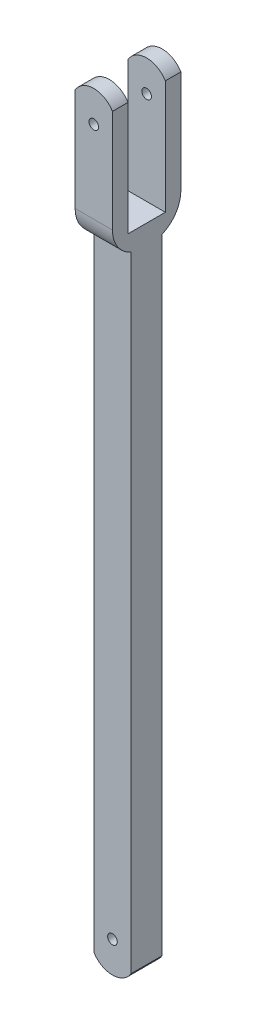
from build123d import *

# Parameters (mm, degrees)
BOSS_EXTRU_1_DEPTH      = 11
BOSS_EXTRU_1_DEPTH_BACK = 11
ESQUISSE3_W             = 16.581408451
ESQUISSE3_H             = 12
ENL_V_MAT_EXTRU_2_DEPTH = 40
CUT_EXTRUDE1_REACH      = 158.809
SKETCH1_R               = 1.55
CUT_EXTRUDE2_DEPTH      = 6
FILLET1_R               = 10


with BuildPart() as part:
    # Esquisse1 → Boss.-Extru.1 (new, two sides: drawn at the far end of the back side and taken through both)
    with BuildSketch(Plane.XY.offset(-BOSS_EXTRU_1_DEPTH_BACK)):
        with BuildLine():
            Line((-6.828531952, -151.713036206), (-6.828531952, 91.498065413))
            ThreePointArc((-6.828531952, 91.498065413), (-0.828532479, 94.89251507), (5.171468048, 91.498067278))
            Line((5.171468048, 91.498067278), (5.171468048, -151.713036206))
            ThreePointArc((5.171468048, -151.713036206), (-0.828531952, -155.10748493), (-6.828531952, -151.713036206))
        make_face()
    extrude(amount=BOSS_EXTRU_1_DEPTH + BOSS_EXTRU_1_DEPTH_BACK)

    # Esquisse3 → Enlèv. mat.-Extru.2 (cut)
    with BuildSketch(Plane(origin=(0, 94.89251507, 0), x_dir=(1, 0, 0), z_dir=(0, 1, 0))):
        with Locations((0.202032035, 0)):
            Rectangle(ESQUISSE3_W, ESQUISSE3_H)
    extrude(amount=-ENL_V_MAT_EXTRU_2_DEPTH, mode=Mode.SUBTRACT)

    # Cut-Extrude1: up to this face of the body (flat: up to its plane)
    cut_extrude1_end = Plane(part.part.faces().sort_by_distance((-0.828531947, -30.10748493, -11))[0])
    # Sketch1 → Cut-Extrude1 (cut, up to the picked face)
    with BuildSketch(Plane.XY.offset(11), mode=Mode.PRIVATE) as cut_extrude1_sk1:
        with Locations((-0.828531952, 84.890414662)):
            Circle(SKETCH1_R)
    cut_extrude1_tool1 = split(extrude(cut_extrude1_sk1.sketch, amount=-CUT_EXTRUDE1_REACH, mode=Mode.PRIVATE), bisect_by=cut_extrude1_end, keep=Keep.BOTH, mode=Mode.PRIVATE)
    # Sketch1 → Cut-Extrude1 (cut, up to the picked face)
    with BuildSketch(Plane.XY.offset(11), mode=Mode.PRIVATE) as cut_extrude1_sk2:
        with Locations((-0.828531952, -145.10748493)):
            Circle(SKETCH1_R)
    cut_extrude1_tool2 = split(extrude(cut_extrude1_sk2.sketch, amount=-CUT_EXTRUDE1_REACH, mode=Mode.PRIVATE), bisect_by=cut_extrude1_end, keep=Keep.BOTH, mode=Mode.PRIVATE)
    add(cut_extrude1_tool1.solids().sort_by(Axis((-0.828532, 84.890415, 11), (0, 0, -1)))[0], mode=Mode.SUBTRACT)
    add(cut_extrude1_tool2.solids().sort_by(Axis((-0.828532, -145.107485, 11), (0, 0, -1)))[0], mode=Mode.SUBTRACT)

    # Sketch4 → Cut-Extrude2 (cut)
    with BuildSketch(Plane.XY.offset(11)):
        with BuildLine():
            Line((-6.828531952, 49.278330566), (-6.828531952, -151.713036206))
            ThreePointArc((-6.828531952, -151.713036206), (-0.828531952, -157.713036206), (5.171468048, -151.713036206))
            Line((5.171468048, -151.713036206), (5.171468048, 49.278330566))
            Line((5.171468048, 49.278330566), (-6.828531952, 49.278330566))
        make_face()
    cut_extrude2 = extrude(amount=-CUT_EXTRUDE2_DEPTH, mode=Mode.SUBTRACT)

    # Mirror1: Cut-Extrude2 across plane
    add(cut_extrude2.mirror(Plane.XY), mode=Mode.SUBTRACT)

    # Fillet1
    # the kernel refuses this fillet: 10 mm, written as the material it takes off along each edge
    with BuildSketch(Plane(origin=(28.084346523, 49.278330566, -11), x_dir=(0, 1, 0), z_dir=(-1, 0, 0))) as fillet1_piece_1:
        with BuildLine():
            CenterArc((9.16515139, -10), FILLET1_R, 90, 66.421821522)
            Line((0, -6), (-0.183303028, -5.92))
            ThreePointArc((-0.183303028, -5.92), (-0.2, -3), (-0.2, 0))
            Line((-0.2, 0), (0, 0.2))
            Line((0, 0.2), (9.16515139, 0.2))
            Line((9.16515139, 0.2), (9.16515139, 0))
        make_face()
    extrude(amount=57.82575695, mode=Mode.SUBTRACT)
    with BuildSketch(Plane(origin=(28.084346523, 49.278330566, 11), x_dir=(0, 1, 0), z_dir=(-1, 0, 0))) as fillet1_piece_2:
        with BuildLine():
            CenterArc((9.16515139, 10), FILLET1_R, 203.578178478, 66.421821522)
            Line((0, 6), (-0.183303028, 5.92))
            ThreePointArc((-0.183303028, 5.92), (-0.2, 3), (-0.2, 0))
            Line((-0.2, 0), (0, -0.2))
            Line((0, -0.2), (9.16515139, -0.2))
            Line((9.16515139, -0.2), (9.16515139, 0))
        make_face()
    extrude(amount=57.82575695, mode=Mode.SUBTRACT)


solid = part.part
